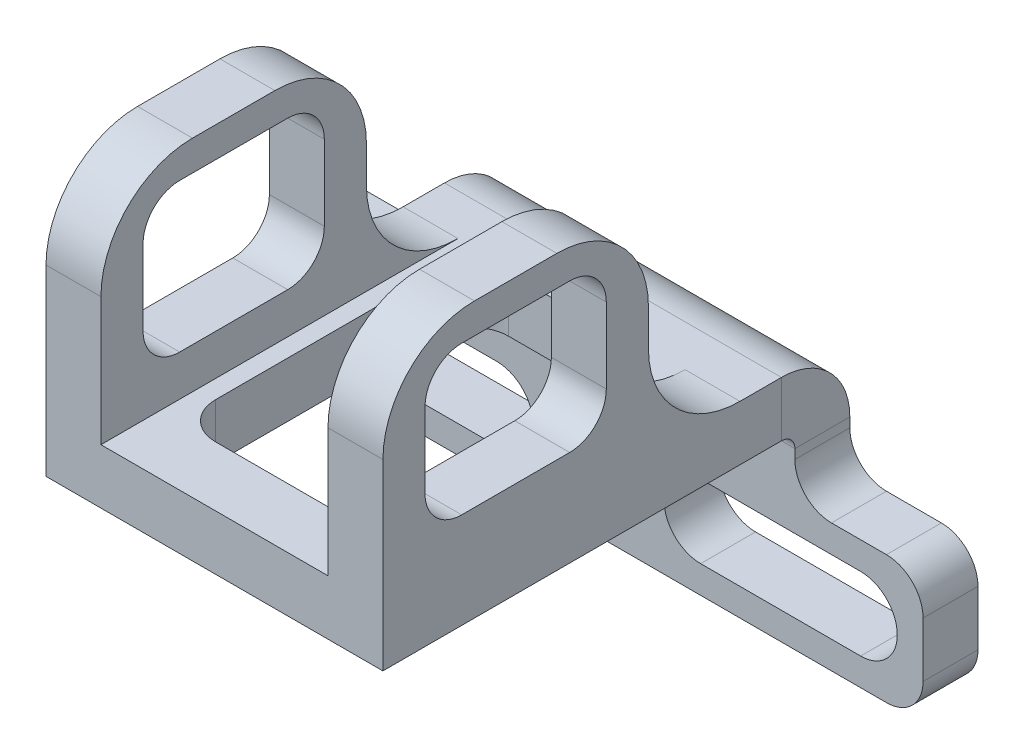
from build123d import *

# Parameters (mm, degrees)
FLANGE_BASE1_DEPTH             = 3
CORTE_EXTRUS_O1_DEPTH          = 3
ARESTA_FLANGE4_STRIP_W         = 13.4732
ARESTA_FLANGE4_STRIP_H         = 3
ARESTA_FLANGE4_STRIP_CUT_DEPTH = 18.4
ARESTA_FLANGE4_DEPTH           = 18.4
ESBO_O47_W                     = 14.5
ESBO_O47_H                     = 15
RESSALTO_EXTRUS_O1_DEPTH       = 3
FILETE1_R                      = 5
ESBO_O48_W                     = 14.5
ESBO_O48_H                     = 15
RESSALTO_EXTRUS_O2_DEPTH       = 3
FILETE2_R                      = 5
FILETE3_R                      = 2
CORTE_EXTRUS_O5_DEPTH          = 42.850190918
CORTE_EXTRUS_O6_DEPTH          = 3


# Sheet-metal steps are written as plain solids
with BuildPart() as part:
    # Esboço1 → Flange-base1 (new body)
    with BuildSketch(Plane.XY):
        Polygon((-14.370772566, 2.693459119), (-4.370772566, 2.693459119), (-4.370772566, 5.943459119), (14.029227434, 5.943459119), (14.029227434, 2.693459119), (21.029227434, 2.693459119), (21.029227434, -4.306540881), (-14.370772566, -4.306540881), align=None)
    extrude(amount=-FLANGE_BASE1_DEPTH)

    # Esboço8 → Corte-extrusão1 (cut)
    with BuildSketch(Plane.XY):
        with BuildLine():
            Line((-10.260200759, 1.193459119), (-2.260200759, 1.193459119))
            ThreePointArc((-2.260200759, 1.193459119), (-0.260200759, -0.806540881), (-2.260200759, -2.806540881))
            Line((-2.260200759, -2.806540881), (-10.260200759, -2.806540881))
            ThreePointArc((-10.260200759, -2.806540881), (-12.260200759, -0.806540881), (-10.260200759, 1.193459119))
        make_face()
        with BuildLine():
            Line((8.88097681, 1.193459119), (17.620096532, 1.193459119))
            ThreePointArc((17.620096532, 1.193459119), (19.620096532, -0.806540881), (17.620096532, -2.806540881))
            Line((17.620096532, -2.806540881), (8.88097681, -2.806540881))
            ThreePointArc((8.88097681, -2.806540881), (6.88097681, -0.806540881), (8.88097681, 1.193459119))
        make_face()
    extrude(amount=-CORTE_EXTRUS_O1_DEPTH, mode=Mode.SUBTRACT)

    # Aresta-Flange4 strip (across the edge) → Aresta-Flange4 strip cut (cut)
    with BuildSketch(Plane(origin=(14.029227434, 5.943459119, 0), x_dir=(0, -1, 0), z_dir=(-1, 0, 0))):
        with Locations((-6, -1.5)):
            Rectangle(ARESTA_FLANGE4_STRIP_W, ARESTA_FLANGE4_STRIP_H)
    extrude(amount=ARESTA_FLANGE4_STRIP_CUT_DEPTH, mode=Mode.SUBTRACT)

    # Aresta-Flange4 section (across the edge) → Aresta-Flange4 (add)
    with BuildSketch(Plane(origin=(14.029227434, 5.943459119, 0), x_dir=(0, -1, 0), z_dir=(-1, 0, 0))):
        with BuildLine():
            Line((-3, 0.7366), (-3, 22.5))
            Line((-3, 22.5), (0, 22.5))
            Line((0, 22.5), (0, 0.7366))
            ThreePointArc((0, 0.7366), (0.215745145, 0.215745145), (0.7366, 0))
            Line((0.7366, 0), (0.7366, -3))
            ThreePointArc((0.7366, -3), (-1.905575199, -1.905575199), (-3, 0.7366))
        make_face()
    extrude(amount=ARESTA_FLANGE4_DEPTH)

    # Esboço47 → Ressalto-extrusão1 (add)
    with BuildSketch(Plane(origin=(14.029227434, 0, 0), x_dir=(0, 0, -1), z_dir=(1, 0, 0))):
        with Locations((-15.25, 13.443459119)):
            Rectangle(ESBO_O47_W, ESBO_O47_H)
    extrude(amount=-RESSALTO_EXTRUS_O1_DEPTH)

    # Filete1
    filete1_edges = [part.edges().sort_by_distance(p)[0] for p in [
        (12.529227434, 20.943459119, 22.5),
        (12.529227434, 8.943459119, 8),
        (12.529227434, 20.943459119, 8),
    ]]
    fillet(filete1_edges, radius=FILETE1_R)

    # Esboço48 → Ressalto-extrusão2 (add)
    with BuildSketch(Plane.ZY.offset(4.370772566)):
        with Locations((15.25, 13.443459119)):
            Rectangle(ESBO_O48_W, ESBO_O48_H)
    extrude(amount=-RESSALTO_EXTRUS_O2_DEPTH)

    # Filete2
    filete2_edges = [part.edges().sort_by_distance(p)[0] for p in [
        (-2.870772566, 20.943459119, 22.5),
        (-2.870772566, 8.943459119, 8),
        (-2.870772566, 20.943459119, 8),
    ]]
    fillet(filete2_edges, radius=FILETE2_R)

    # Filete3
    filete3_edges = [part.edges().sort_by_distance(p)[0] for p in [
        (21.029227434, -4.306540881, -1.5),
        (-14.370772566, -4.306540881, -1.5),
        (-14.370772566, 2.693459119, -1.5),
        (-4.370772566, 2.693459119, -1.5),
        (14.029227434, 2.693459119, -1.5),
        (21.029227434, 2.693459119, -1.5),
    ]]
    fillet(filete3_edges, radius=FILETE3_R)

    # Esboço49 → Corte-extrusão5 (cut, through all)
    with BuildSketch(Plane(origin=(14.029227434, 0, 0), x_dir=(0, 0, -1), z_dir=(1, 0, 0))):
        with BuildLine():
            Line((-18.2, 11.175198381), (-12.3, 11.175198381))
            ThreePointArc((-12.3, 11.175198381), (-10.885786438, 11.760984819), (-10.3, 13.175198381))
            Line((-10.3, 13.175198381), (-10.3, 17.289297618))
            ThreePointArc((-10.3, 17.289297618), (-10.885786438, 18.70351118), (-12.3, 19.289297618))
            Line((-12.3, 19.289297618), (-18.2, 19.289297618))
            ThreePointArc((-18.2, 19.289297618), (-19.614213562, 18.70351118), (-20.2, 17.289297618))
            Line((-20.2, 17.289297618), (-20.2, 13.175198381))
            ThreePointArc((-20.2, 13.175198381), (-19.614213562, 11.760984819), (-18.2, 11.175198381))
        make_face()
    extrude(amount=-CORTE_EXTRUS_O5_DEPTH, mode=Mode.SUBTRACT)

    # Esboço50 → Corte-extrusão6 (cut)
    with BuildSketch(Plane.XZ.offset(-5.943459119)):
        with BuildLine():
            Line((1.629227434, 19.2366), (8.029227434, 19.2366))
            ThreePointArc((8.029227434, 19.2366), (9.443440996, 18.650813562), (10.029227434, 17.2366))
            Line((10.029227434, 17.2366), (10.029227434, 5.2366))
            ThreePointArc((10.029227434, 5.2366), (9.443440996, 3.822386438), (8.029227434, 3.2366))
            Line((8.029227434, 3.2366), (1.629227434, 3.2366))
            ThreePointArc((1.629227434, 3.2366), (0.215013871, 3.822386438), (-0.370772566, 5.2366))
            Line((-0.370772566, 5.2366), (-0.370772566, 17.2366))
            ThreePointArc((-0.370772566, 17.2366), (0.215013871, 18.650813562), (1.629227434, 19.2366))
        make_face()
    extrude(amount=-CORTE_EXTRUS_O6_DEPTH, mode=Mode.SUBTRACT)


solid = part.part
